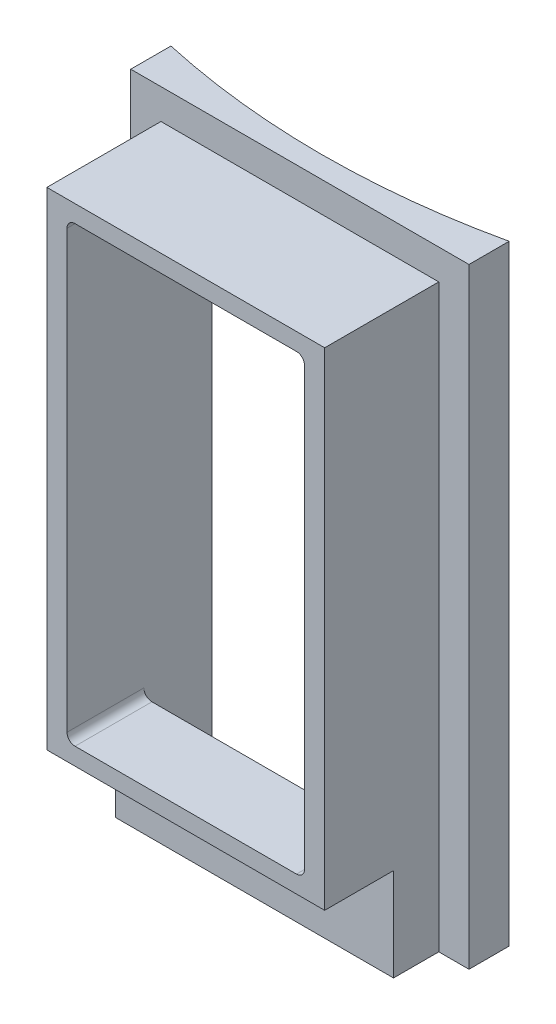
from build123d import *

# Parameters (mm, degrees)
SKETCH1_W           = 106.68
SKETCH1_H           = 192.532
EXTRUDE1_DEPTH      = 252.4252
SKETCH7_W           = 87.63
SKETCH7_H           = 183.007
EXTRUDE5_DEPTH      = 35.98418
EXTRUDE2_DEPTH      = 42.08
EXTRUDE2_DEPTH_BACK = 273.8502
SKETCH4_W           = 74.93
SKETCH4_H           = 142.748
SKETCH10_W          = 74.93
SKETCH10_H          = 2.921
SKETCH10_H_2        = 32.258
EXTRUDE8_DEPTH      = 264.16
SKETCH11_W          = 74.93
SKETCH11_H          = 2.921
EXTRUDE9_DEPTH      = 21.59
FILLET1_R           = 2.54
SKETCH2_R           = 245.618
EXTRUDE4_DEPTH      = 230
SKETCH12_W          = 87.63
SKETCH12_H          = 29.337
EXTRUDE10_DEPTH     = 21.70938


with BuildPart() as part:
    # Sketch1 → Extrude1 (new body)
    with BuildSketch(Plane.XY):
        with Locations((6.35, -9.906)):
            Rectangle(SKETCH1_W, SKETCH1_H)
    extrude(amount=EXTRUDE1_DEPTH)

    # Sketch7 → Extrude5 (add)
    with BuildSketch(Plane.XY.offset(252.4252)):
        with Locations((6.35, -14.6685)):
            Rectangle(SKETCH7_W, SKETCH7_H)
    extrude(amount=EXTRUDE5_DEPTH)

    # Sketch4 → Extrude2 (cut, two sides: drawn at the far end of the back side and taken through both)
    with BuildSketch(Plane.XY.offset(252.4252).offset(-EXTRUDE2_DEPTH_BACK)):
        with Locations((6.35, 0)):
            Rectangle(SKETCH4_W, SKETCH4_H)
    extrude(amount=EXTRUDE2_DEPTH + EXTRUDE2_DEPTH_BACK, mode=Mode.SUBTRACT)

    # Sketch10 → Extrude8 (cut)
    with BuildSketch(Plane(origin=(0, 0, 0), x_dir=(-1, 0, 0), z_dir=(0, 0, -1))):
        with Locations((-6.35, 72.8345)):
            Rectangle(SKETCH10_W, SKETCH10_H)
        with Locations((-6.35, -87.503)):
            Rectangle(SKETCH10_W, SKETCH10_H_2)
    extrude(amount=-EXTRUDE8_DEPTH, mode=Mode.SUBTRACT)

    # Sketch11 → Extrude9 (cut)
    with BuildSketch(Plane(origin=(0, 0, 264.16), x_dir=(-1, 0, 0), z_dir=(0, 0, -1))):
        with Locations((-6.35, 72.8345)):
            Rectangle(SKETCH11_W, SKETCH11_H)
    extrude(amount=-EXTRUDE9_DEPTH, mode=Mode.SUBTRACT)

    # Fillet1
    fillet1_edges = [part.edges().sort_by_distance(p)[0] for p in [
        (43.815, -71.374, 276.28469),
        (-31.115, -71.374, 276.28469),
        (43.815, 71.374, 287.07969),
        (-31.115, 71.374, 287.07969),
        (43.815, -103.632, 132.08),
        (-31.115, -103.632, 132.08),
        (-31.115, 74.295, 142.875),
        (43.815, 74.295, 142.875),
    ]]
    fillet(fillet1_edges, radius=FILLET1_R)

    # Sketch2 → Extrude4 (cut)
    with BuildSketch(Plane(origin=(0, 86.36, 0), x_dir=(-1, 0, 0), z_dir=(0, 1, 0))):
        with Locations((-6.35, 0)):
            Circle(SKETCH2_R)
    extrude(amount=-EXTRUDE4_DEPTH, mode=Mode.SUBTRACT)

    # Sketch12 → Extrude10 (cut)
    with BuildSketch(Plane.XY.offset(288.40938)):
        with Locations((6.35, -91.5035)):
            Rectangle(SKETCH12_W, SKETCH12_H)
    extrude(amount=-EXTRUDE10_DEPTH, mode=Mode.SUBTRACT)


solid = part.part
